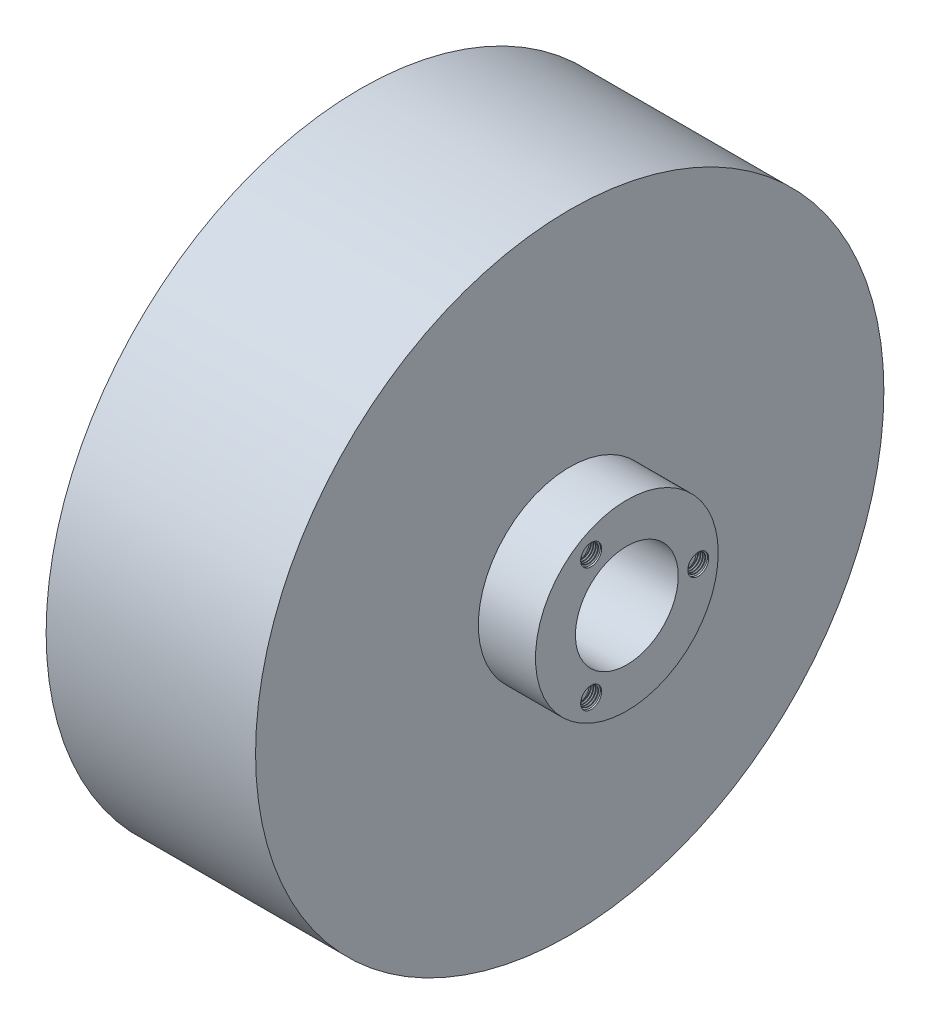
from build123d import *
from build123d.topology import SkipClean

# Parameters (mm, degrees)
SKETCH1_R           = 165
BOSS_EXTRUDE1_DEPTH = 110
SKETCH2_R           = 48
BOSS_EXTRUDE2_DEPTH = 30
SKETCH3_R           = 27
CUT_EXTRUDE1_DEPTH  = 40
SKETCH12_R          = 5.5
CUT_EXTRUDE2_DEPTH  = 6
CIRPATTERN1_COUNT   = 3
THREAD1_PITCH       = 1.25
THREAD2_PITCH       = 1.25
THREAD3_PITCH       = 1.25


with BuildPart() as part:
    # Sketch1 → Boss-Extrude1 (new body)
    with BuildSketch(Plane(origin=(0, 0, 0), x_dir=(0, 0, -1), z_dir=(1, 0, 0))):
        Circle(SKETCH1_R)
    extrude(amount=BOSS_EXTRUDE1_DEPTH)

    # Sketch2 → Boss-Extrude2 (add)
    with BuildSketch(Plane(origin=(110, 0, 0), x_dir=(0, 0, -1), z_dir=(1, 0, 0))):
        Circle(SKETCH2_R)
    extrude(amount=BOSS_EXTRUDE2_DEPTH)

    # Sketch3 → Cut-Extrude1 (cut)
    with BuildSketch(Plane(origin=(140, 0, 0), x_dir=(0, 0, -1), z_dir=(1, 0, 0))):
        Circle(SKETCH3_R)
    extrude(amount=-CUT_EXTRUDE1_DEPTH, mode=Mode.SUBTRACT)

    # Sketch12 → Cut-Extrude2 (cut)
    with BuildSketch(Plane(origin=(140, 0, 0), x_dir=(0, 0, -1), z_dir=(1, 0, 0))):
        with Locations((37.5, 0)):
            Circle(SKETCH12_R)
    cut_extrude2 = extrude(amount=-CUT_EXTRUDE2_DEPTH, mode=Mode.SUBTRACT)

    # CirPattern1: Cut-Extrude2 ×3 about axis
    cirpattern1_axis = Axis((0, 0, 0), (1, 0, 0))
    for i in range(1, CIRPATTERN1_COUNT):
        add(cut_extrude2.rotate(cirpattern1_axis, i * 360 / CIRPATTERN1_COUNT), mode=Mode.SUBTRACT)

    # Thread1: the profile of Thread Profile2 profile screwed along a right-hand helix of 4.8 turns, 8 arcs to a turn; built about Z, then put on its axis
    with SkipClean():  # the faces are left unmerged after this step: merging them gives an invalid solid
        thread1_z = Axis((0, 0, 0), (0, 0, 1))
        thread1_corners = [(5.5003, 0, -0.000173205), (5.5003, 0, 1.093923202), (4.823417656, 0, 0.703124998), (4.823417656, 0, 0.390624998)]
        with BuildLine(mode=Mode.PRIVATE) as thread1_profile:
            Line(thread1_corners[0], thread1_corners[1])
            Line(thread1_corners[1], thread1_corners[2])
            Line(thread1_corners[2], thread1_corners[3])
            Line(thread1_corners[3], thread1_corners[0])
        thread1_cap = Face(thread1_profile.wire())
        thread1_turn_angles = [0, 22.5, 45, 67.5, 90, 112.5, 135, 157.5, 180, 202.5, 225, 247.5, 270, 292.5, 315, 337.5, 360]
        thread1_turn_weights = [1, 0.9238795325112867, 1, 0.9238795325112867, 1, 0.9238795325112867, 1, 0.9238795325112867, 1, 0.9238795325112867, 1, 0.9238795325112867, 1, 0.9238795325112867, 1, 0.9238795325112867, 1]
        thread1_turn_rails = [Edge.make_bspline([Vector(p[0], p[1], 0).rotate(thread1_z, thread1_turn_angles[k]) / thread1_turn_weights[k] + Vector(0, 0, p[2] + THREAD1_PITCH * thread1_turn_angles[k] / 360) for k in range(17)], [0, 0, 0, 1, 1, 2, 2, 3, 3, 4, 4, 5, 5, 6, 6, 7, 7, 8, 8, 8], 2, thread1_turn_weights) for p in thread1_corners]
        thread1_turn_sides = [Face.make_surface_from_curves(thread1_turn_rails[p[0]], thread1_turn_rails[p[1]]) for p in [(0, 1), (1, 2), (2, 3), (3, 0)]]
        thread1_last_angles = [1440, 1462.5, 1485, 1507.5, 1530, 1552.5, 1575, 1597.5, 1620, 1642.5, 1665, 1687.5, 1710, 1719, 1728]
        thread1_last_weights = [1, 0.9238795325112867, 1, 0.9238795325112867, 1, 0.9238795325112867, 1, 0.9238795325112867, 1, 0.9238795325112867, 1, 0.9238795325112867, 1, 0.9876883405951359, 1]
        thread1_last_rails = [Edge.make_bspline([Vector(p[0], p[1], 0).rotate(thread1_z, thread1_last_angles[k]) / thread1_last_weights[k] + Vector(0, 0, p[2] + THREAD1_PITCH * thread1_last_angles[k] / 360) for k in range(15)], [0, 0, 0, 1, 1, 2, 2, 3, 3, 4, 4, 5, 5, 6, 6, 7, 7, 7], 2, thread1_last_weights) for p in thread1_corners]
        thread1_last_sides = [Face.make_surface_from_curves(thread1_last_rails[p[0]], thread1_last_rails[p[1]]) for p in [(0, 1), (1, 2), (2, 3), (3, 0)]]
        thread1 = Plane(origin=(140, 0, -37.5), x_dir=(0, 0, 1), z_dir=(-1, 0, 0)) * Solid(Shell([*[p.moved(Location((0, 0, THREAD1_PITCH * i))) for i in range(4) for p in thread1_turn_sides], *thread1_last_sides, thread1_cap, thread1_cap.rotate(thread1_z, 1728).moved(Location((0, 0, THREAD1_PITCH * 1728 / 360)))]))
        add(thread1)

    # Thread2: the profile of Thread Profile3 profile screwed along a right-hand helix of 4.8 turns, 8 arcs to a turn; built about Z, then put on its axis
    with SkipClean():  # the faces are left unmerged after this step: merging them gives an invalid solid
        thread2_z = Axis((0, 0, 0), (0, 0, 1))
        thread2_corners = [(5.5003, 0, -0.000173205), (5.5003, 0, 1.093923202), (4.823417656, 0, 0.703124998), (4.823417656, 0, 0.390624998)]
        with BuildLine(mode=Mode.PRIVATE) as thread2_profile:
            Line(thread2_corners[0], thread2_corners[1])
            Line(thread2_corners[1], thread2_corners[2])
            Line(thread2_corners[2], thread2_corners[3])
            Line(thread2_corners[3], thread2_corners[0])
        thread2_cap = Face(thread2_profile.wire())
        thread2_turn_angles = [0, 22.5, 45, 67.5, 90, 112.5, 135, 157.5, 180, 202.5, 225, 247.5, 270, 292.5, 315, 337.5, 360]
        thread2_turn_weights = [1, 0.9238795325112867, 1, 0.9238795325112867, 1, 0.9238795325112867, 1, 0.9238795325112867, 1, 0.9238795325112867, 1, 0.9238795325112867, 1, 0.9238795325112867, 1, 0.9238795325112867, 1]
        thread2_turn_rails = [Edge.make_bspline([Vector(p[0], p[1], 0).rotate(thread2_z, thread2_turn_angles[k]) / thread2_turn_weights[k] + Vector(0, 0, p[2] + THREAD2_PITCH * thread2_turn_angles[k] / 360) for k in range(17)], [0, 0, 0, 1, 1, 2, 2, 3, 3, 4, 4, 5, 5, 6, 6, 7, 7, 8, 8, 8], 2, thread2_turn_weights) for p in thread2_corners]
        thread2_turn_sides = [Face.make_surface_from_curves(thread2_turn_rails[p[0]], thread2_turn_rails[p[1]]) for p in [(0, 1), (1, 2), (2, 3), (3, 0)]]
        thread2_last_angles = [1440, 1462.5, 1485, 1507.5, 1530, 1552.5, 1575, 1597.5, 1620, 1642.5, 1665, 1687.5, 1710, 1719, 1728]
        thread2_last_weights = [1, 0.9238795325112867, 1, 0.9238795325112867, 1, 0.9238795325112867, 1, 0.9238795325112867, 1, 0.9238795325112867, 1, 0.9238795325112867, 1, 0.9876883405951359, 1]
        thread2_last_rails = [Edge.make_bspline([Vector(p[0], p[1], 0).rotate(thread2_z, thread2_last_angles[k]) / thread2_last_weights[k] + Vector(0, 0, p[2] + THREAD2_PITCH * thread2_last_angles[k] / 360) for k in range(15)], [0, 0, 0, 1, 1, 2, 2, 3, 3, 4, 4, 5, 5, 6, 6, 7, 7, 7], 2, thread2_last_weights) for p in thread2_corners]
        thread2_last_sides = [Face.make_surface_from_curves(thread2_last_rails[p[0]], thread2_last_rails[p[1]]) for p in [(0, 1), (1, 2), (2, 3), (3, 0)]]
        thread2 = Plane(origin=(140, 32.475952642, 18.75), x_dir=(0, 0, 1), z_dir=(-1, 0, 0)) * Solid(Shell([*[p.moved(Location((0, 0, THREAD2_PITCH * i))) for i in range(4) for p in thread2_turn_sides], *thread2_last_sides, thread2_cap, thread2_cap.rotate(thread2_z, 1728).moved(Location((0, 0, THREAD2_PITCH * 1728 / 360)))]))
        add(thread2)

    # Thread3: the profile of Thread Profile4 profile screwed along a right-hand helix of 4.8 turns, 8 arcs to a turn; built about Z, then put on its axis
    with SkipClean():  # the faces are left unmerged after this step: merging them gives an invalid solid
        thread3_z = Axis((0, 0, 0), (0, 0, 1))
        thread3_corners = [(5.5003, 0, -0.000173205), (5.5003, 0, 1.093923202), (4.823417656, 0, 0.703124998), (4.823417656, 0, 0.390624998)]
        with BuildLine(mode=Mode.PRIVATE) as thread3_profile:
            Line(thread3_corners[0], thread3_corners[1])
            Line(thread3_corners[1], thread3_corners[2])
            Line(thread3_corners[2], thread3_corners[3])
            Line(thread3_corners[3], thread3_corners[0])
        thread3_cap = Face(thread3_profile.wire())
        thread3_turn_angles = [0, 22.5, 45, 67.5, 90, 112.5, 135, 157.5, 180, 202.5, 225, 247.5, 270, 292.5, 315, 337.5, 360]
        thread3_turn_weights = [1, 0.9238795325112867, 1, 0.9238795325112867, 1, 0.9238795325112867, 1, 0.9238795325112867, 1, 0.9238795325112867, 1, 0.9238795325112867, 1, 0.9238795325112867, 1, 0.9238795325112867, 1]
        thread3_turn_rails = [Edge.make_bspline([Vector(p[0], p[1], 0).rotate(thread3_z, thread3_turn_angles[k]) / thread3_turn_weights[k] + Vector(0, 0, p[2] + THREAD3_PITCH * thread3_turn_angles[k] / 360) for k in range(17)], [0, 0, 0, 1, 1, 2, 2, 3, 3, 4, 4, 5, 5, 6, 6, 7, 7, 8, 8, 8], 2, thread3_turn_weights) for p in thread3_corners]
        thread3_turn_sides = [Face.make_surface_from_curves(thread3_turn_rails[p[0]], thread3_turn_rails[p[1]]) for p in [(0, 1), (1, 2), (2, 3), (3, 0)]]
        thread3_last_angles = [1440, 1462.5, 1485, 1507.5, 1530, 1552.5, 1575, 1597.5, 1620, 1642.5, 1665, 1687.5, 1710, 1719, 1728]
        thread3_last_weights = [1, 0.9238795325112867, 1, 0.9238795325112867, 1, 0.9238795325112867, 1, 0.9238795325112867, 1, 0.9238795325112867, 1, 0.9238795325112867, 1, 0.9876883405951359, 1]
        thread3_last_rails = [Edge.make_bspline([Vector(p[0], p[1], 0).rotate(thread3_z, thread3_last_angles[k]) / thread3_last_weights[k] + Vector(0, 0, p[2] + THREAD3_PITCH * thread3_last_angles[k] / 360) for k in range(15)], [0, 0, 0, 1, 1, 2, 2, 3, 3, 4, 4, 5, 5, 6, 6, 7, 7, 7], 2, thread3_last_weights) for p in thread3_corners]
        thread3_last_sides = [Face.make_surface_from_curves(thread3_last_rails[p[0]], thread3_last_rails[p[1]]) for p in [(0, 1), (1, 2), (2, 3), (3, 0)]]
        thread3 = Plane(origin=(140, -32.475952642, 18.75), x_dir=(0, 0, 1), z_dir=(-1, 0, 0)) * Solid(Shell([*[p.moved(Location((0, 0, THREAD3_PITCH * i))) for i in range(4) for p in thread3_turn_sides], *thread3_last_sides, thread3_cap, thread3_cap.rotate(thread3_z, 1728).moved(Location((0, 0, THREAD3_PITCH * 1728 / 360)))]))
        add(thread3)


solid = part.part
